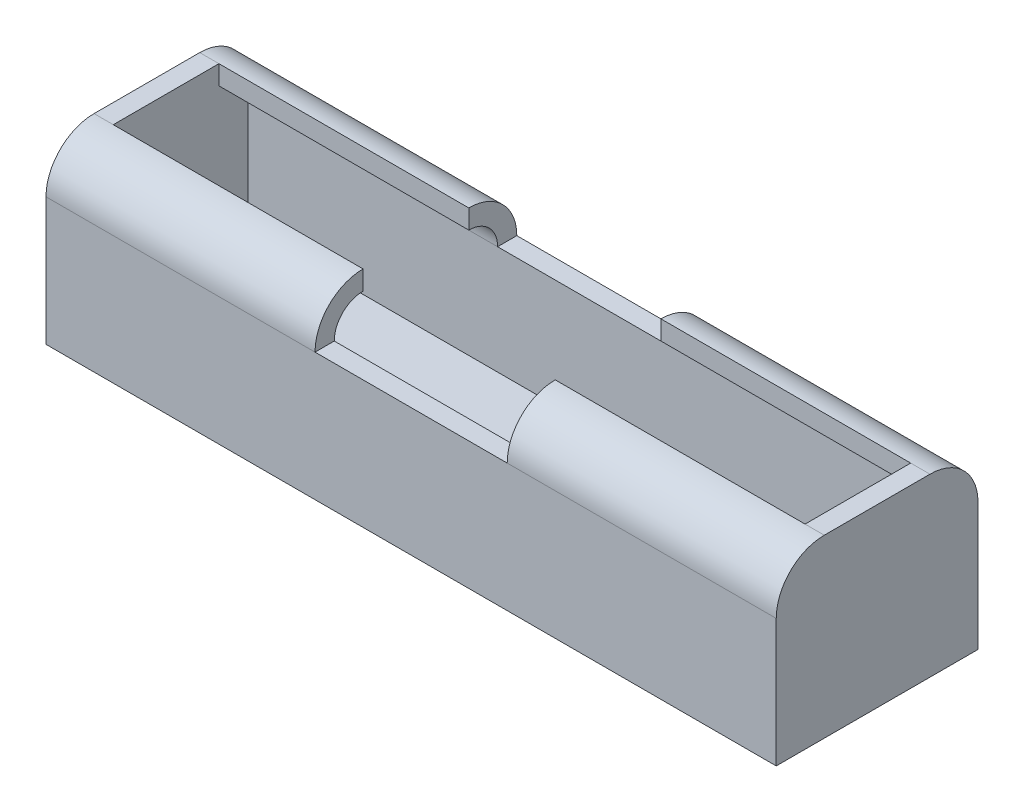
from build123d import *

# Parameters (mm, degrees)
BODY_DEPTH          = 38
SHELL1_START        = -36
SHELL1_DEPTH        = 72
HOLE_DEPTH          = 41.471872949
HOLE_DEPTH_BACK     = 41.471872949
SKETCH2_W           = 20
SKETCH2_H           = 5
SKETCH3_R           = 1.75
FIXATION_HOLE_DEPTH = 43.660754799


# Read off the part's stored shape, not the designer's step: Shell1
with BuildPart() as part:
    # Sketch1 → Body (new, symmetric)
    with BuildSketch(Plane(origin=(0, 0, 0), x_dir=(0, 0, -1), z_dir=(1, 0, 0))):
        with BuildLine():
            Line((10.5, -9.15), (-10.5, -9.15))
            Line((-10.5, -9.15), (-10.5, 4.15))
            ThreePointArc((-10.5, 4.15), (-9.035533906, 7.685533906), (-5.5, 9.15))
            Line((-5.5, 9.15), (5.5, 9.15))
            ThreePointArc((5.5, 9.15), (9.035533906, 7.685533906), (10.5, 4.15))
            Line((10.5, 4.15), (10.5, -9.15))
        make_face()
    extrude(amount=BODY_DEPTH, both=True)

    # Shell1 outline → Shell1 (cut)
    with BuildSketch(Plane.YZ.offset(SHELL1_START)):
        with BuildLine():
            Line((7.15, -5.5), (9.15, -5.5))
            Line((9.15, -5.5), (9.15, 5.5))
            Line((9.15, 5.5), (7.15, 5.5))
            ThreePointArc((7.15, 5.5), (6.271320344, 7.621320344), (4.15, 8.5))
            Line((4.15, 8.5), (-7.15, 8.5))
            Line((-7.15, 8.5), (-7.15, -8.5))
            Line((-7.15, -8.5), (4.15, -8.5))
            ThreePointArc((4.15, -8.5), (6.271320344, -7.621320344), (7.15, -5.5))
        make_face()
    extrude(amount=SHELL1_DEPTH, mode=Mode.SUBTRACT)

    # Sketch2 → Hole (cut, two sides: drawn at the far end of the back side and taken through both)
    with BuildSketch(Plane.XY.offset(-HOLE_DEPTH_BACK)):
        with Locations((0, 6.65)):
            Rectangle(SKETCH2_W, SKETCH2_H)
    extrude(amount=HOLE_DEPTH + HOLE_DEPTH_BACK, mode=Mode.SUBTRACT)

    # Sketch3 → Fixation_Hole (cut, through all)
    with BuildSketch(Plane(origin=(0, -7.15, 0), x_dir=(1, 0, 0), z_dir=(0, 1, 0))):
        with Locations(Location((0, 0, 0), (0, 0, 270))):
            Circle(SKETCH3_R)
    extrude(amount=-FIXATION_HOLE_DEPTH, mode=Mode.SUBTRACT)


solid = part.part
